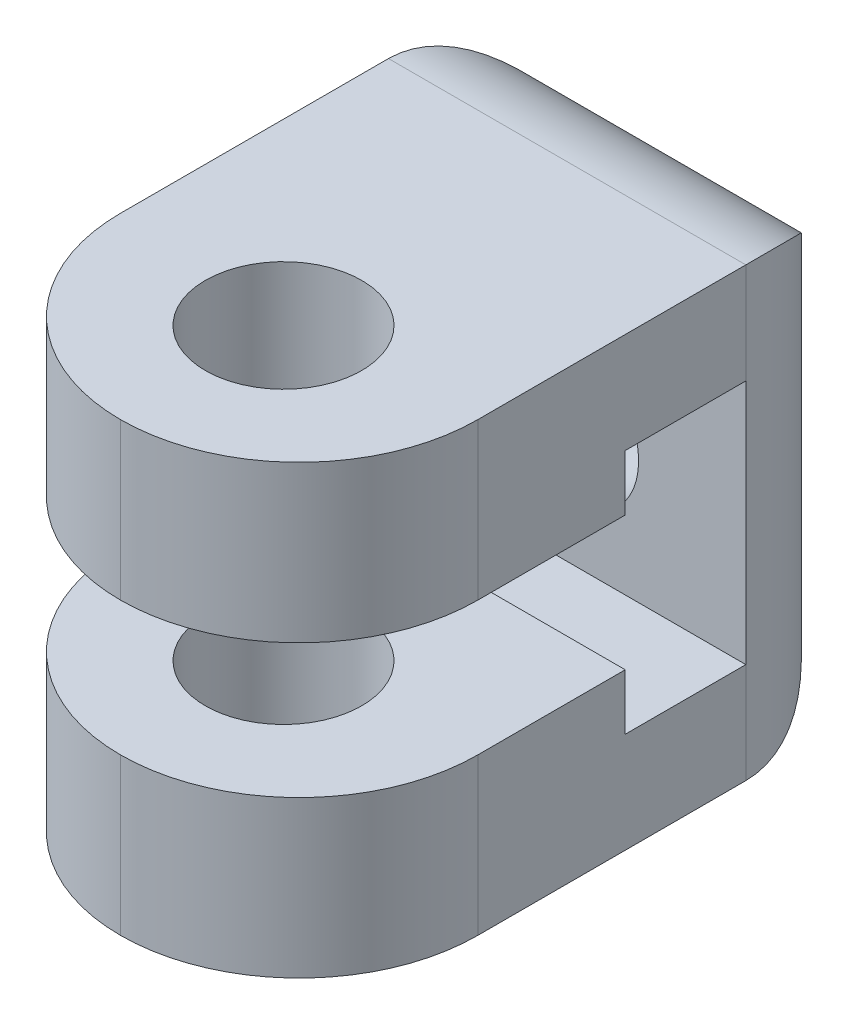
from build123d import *

# Parameters (mm, degrees)
SKETCH1_W           = 8
SKETCH1_H           = 10
BOSS_EXTRUDE1_DEPTH = 3
SKETCH2_W           = 8
SKETCH2_H           = 3.5
BOSS_EXTRUDE2_DEPTH = 10
CUT_EXTRUDE1_START  = -8
SKETCH3_W           = 2.7
SKETCH3_H           = 5.5
CUT_EXTRUDE1_DEPTH  = 8
CUT_EXTRUDE2_REACH  = 16.491
SKETCH4_R           = 1.6
SKETCH5_R           = 1.75
CUT_EXTRUDE3_DEPTH  = 17.881943016
FILLET1_R           = 4
FILLET2_START       = -5
FILLET2_DEPTH       = 10
FILLET2_2_DEPTH     = 10


with BuildPart() as part:
    # Sketch1 → Boss-Extrude1 (new body)
    with BuildSketch(Plane.XY):
        Rectangle(SKETCH1_W, SKETCH1_H)
    extrude(amount=BOSS_EXTRUDE1_DEPTH)

    # Sketch2 → Boss-Extrude2 (add)
    with BuildSketch(Plane.XY.offset(3)):
        with Locations((0, 3.25)):
            Rectangle(SKETCH2_W, SKETCH2_H)
        with Locations((0, -3.25)):
            Rectangle(SKETCH2_W, SKETCH2_H)
    extrude(amount=BOSS_EXTRUDE2_DEPTH)

    # Sketch3 → Cut-Extrude1 (cut)
    with BuildSketch(Plane(origin=(4, 0, 0), x_dir=(0, 0, -1), z_dir=(1, 0, 0)).offset(CUT_EXTRUDE1_START)):
        with Locations((-4.35, 0)):
            Rectangle(SKETCH3_W, SKETCH3_H)
    extrude(amount=CUT_EXTRUDE1_DEPTH, mode=Mode.SUBTRACT)

    # Sketch4 → Cut-Extrude2 (cut, up to next)
    with BuildSketch(Plane(origin=(0, 0, 0), x_dir=(-1, 0, 0), z_dir=(0, 0, -1)), mode=Mode.PRIVATE) as cut_extrude2_sk1:
        Circle(SKETCH4_R)
    cut_extrude2_tool1 = extrude(cut_extrude2_sk1.sketch, amount=-CUT_EXTRUDE2_REACH, mode=Mode.PRIVATE) & part.part
    add(cut_extrude2_tool1.solids().sort_by_distance((0, 0, 0))[0], mode=Mode.SUBTRACT)

    # Sketch5 → Cut-Extrude3 (cut, through all)
    with BuildSketch(Plane(origin=(0, 5, 0), x_dir=(1, 0, 0), z_dir=(0, 1, 0))):
        with Locations(Location((0, -9.35, 0), (0, 0, 180))):
            Circle(SKETCH5_R)
    extrude(amount=-CUT_EXTRUDE3_DEPTH, mode=Mode.SUBTRACT)

    # Fillet1
    fillet1_edges = [part.edges().sort_by_distance(p)[0] for p in [
        (-4, -3.25, 13),
        (-4, 3.25, 13),
        (4, -3.25, 13),
        (4, 3.25, 13),
    ]]
    fillet(fillet1_edges, radius=FILLET1_R - 0.0001)  # a hair under: the kernel refuses the full size

    # Fillet2: read off the stored shape, not the designer's step
    # Fillet2 outline → Fillet2 (cut)
    with BuildSketch(Plane(origin=(0, 0, 0), x_dir=(1, 0, 0), z_dir=(0, 1, 0)).offset(FILLET2_START)):
        with BuildLine():
            ThreePointArc((-4, -3), (-3.121320344, -0.878679656), (-1, 0))
            Line((-1, 0), (-4, 0))
            Line((-4, 0), (-4, -3))
        make_face()
        with BuildLine():
            ThreePointArc((1, 0), (3.121320344, -0.878679656), (4, -3))
            Line((4, -3), (4, 0))
            Line((4, 0), (1, 0))
        make_face()
    extrude(amount=FILLET2_DEPTH, mode=Mode.SUBTRACT)

    # Fillet2 2 outline → Fillet2 2 (cut)
    with BuildSketch(Plane.YZ.offset(FILLET2_START)):
        with BuildLine():
            Line((5, 0), (5, 3))
            ThreePointArc((5, 3), (4.121320344, 0.878679656), (2, 0))
            Line((2, 0), (5, 0))
        make_face()
        with BuildLine():
            ThreePointArc((-2, 0), (-4.121320344, 0.878679656), (-5, 3))
            Line((-5, 3), (-5, 0))
            Line((-5, 0), (-2, 0))
        make_face()
    extrude(amount=FILLET2_2_DEPTH, mode=Mode.SUBTRACT)


solid = part.part
